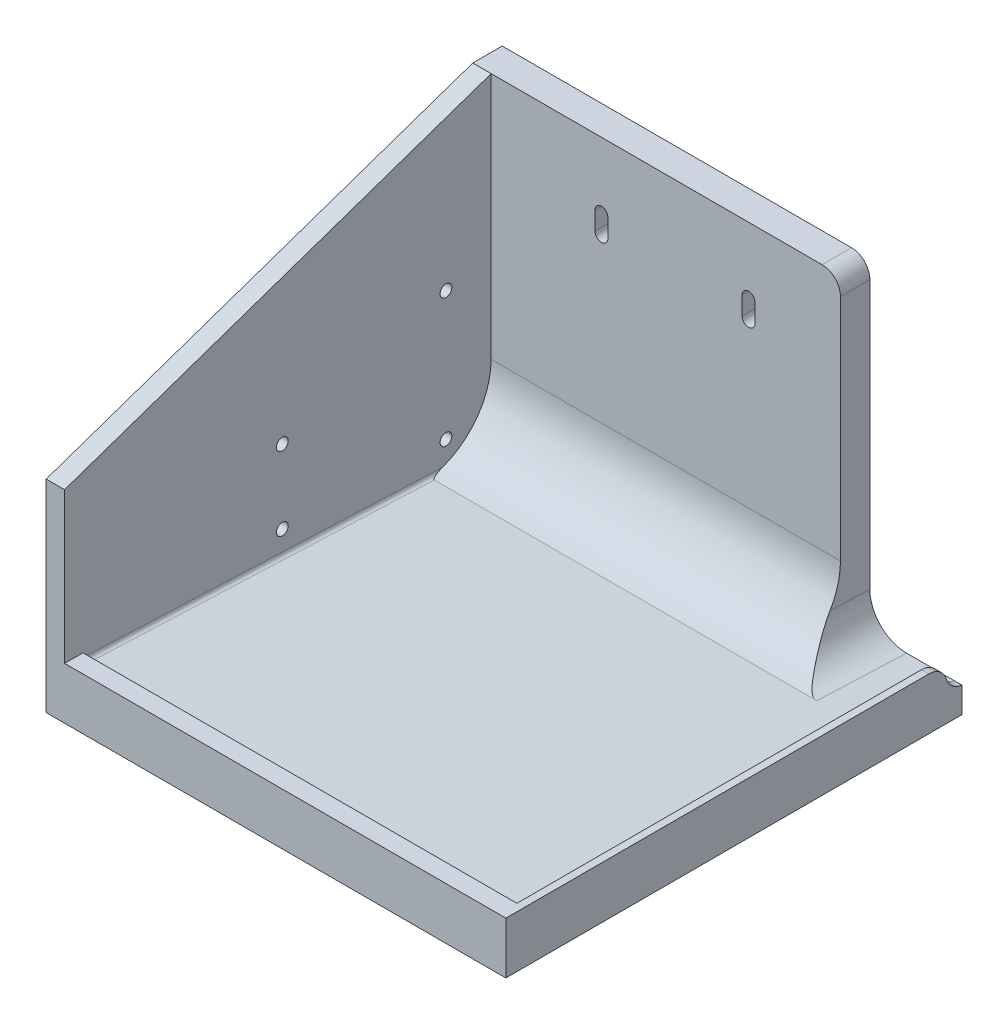
from build123d import *

# Parameters (mm, degrees)
SKETCH1_W            = 155
SKETCH1_H            = 5
BOSS_EXTRUDE2_DEPTH  = 55
SKETCH2_W            = 112
SKETCH2_H            = 45
SKETCH2_R            = 1.75
CUT_EXTRUDE1_DEPTH   = 55
SKETCH3_W            = 100
SKETCH3_H            = 20
CUT_EXTRUDE2_DEPTH   = 55
SKETCH4_W            = 40
SKETCH4_H            = 8.065867699
CUT_EXTRUDE3_DEPTH   = 55
BOSS_EXTRUDE4_DEPTH  = 5
CUT_EXTRUDE4_DEPTH   = 50
SKETCH9_W            = 4.377781836
SKETCH9_H            = 86.488706471
BOSS_EXTRUDE7_DEPTH  = 50
SKETCH10_W           = 20
SKETCH10_H           = 86.532324722
CUT_EXTRUDE5_DEPTH   = 10
SKETCH12_R           = 9.5
SKETCH12_R_2         = 6
CUT_EXTRUDE6_DEPTH   = 10
CUT_EXTRUDE7_START   = 50
SKETCH13_R           = 9.5
SKETCH13_R_2         = 6
CUT_EXTRUDE7_DEPTH   = 50
CUT_EXTRUDE8_DEPTH   = 50
CUT_EXTRUDE9_DEPTH   = 50
CUT_EXTRUDE10_DEPTH  = 10
FILLET5_R            = 3
SKETCH18_W           = 98.767816147
SKETCH18_H           = 10.604205858
BOSS_EXTRUDE8_DEPTH  = 5
CUT_EXTRUDE11_DEPTH  = 5
SKETCH20_W           = 155
SKETCH20_H           = 119
BOSS_EXTRUDE9_DEPTH  = 10
CUT_EXTRUDE13_DEPTH  = 155
SKETCH24_W           = 125
SKETCH24_H           = 8
BOSS_EXTRUDE10_DEPTH = 95
FILLET6_R            = 20
SKETCH26_W           = 16
SKETCH26_H           = 1.5
BOSS_EXTRUDE11_DEPTH = 12
BOSS_EXTRUDE12_DEPTH = 15
SKETCH28_R           = 2.5
CUT_EXTRUDE15_DEPTH  = 5
CUT_EXTRUDE17_DEPTH  = 35
SKETCH29_W           = 43
SKETCH29_H           = 43
CUT_EXTRUDE18_DEPTH  = 35
FILLET9_R            = 10
SKETCH31_W           = 124
SKETCH31_H           = 12
BOSS_EXTRUDE14_DEPTH = 2
SKETCH32_W           = 5
SKETCH32_H           = 2
BOSS_EXTRUDE15_DEPTH = 132
SKETCH33_W           = 20
SKETCH33_H           = 12
CUT_EXTRUDE19_DEPTH  = 160
SKETCH34_W           = 2
SKETCH34_H           = 12
BOSS_EXTRUDE17_DEPTH = 123
SKETCH36_R           = 6
CUT_EXTRUDE20_DEPTH  = 40
CUT_EXTRUDE21_DEPTH  = 25
SKETCH39_W           = 10
SKETCH39_H           = 12
CUT_EXTRUDE22_DEPTH  = 165
SKETCH40_W           = 2
SKETCH40_H           = 12
BOSS_EXTRUDE18_DEPTH = 115
SKETCH41_W           = 5
SKETCH41_H           = 64.538049938
BOSS_EXTRUDE19_DEPTH = 5
BOSS_EXTRUDE20_REACH = 223.912
SKETCH42_W           = 10
SKETCH42_H           = 124
SKETCH45_R           = 1.6
CUT_EXTRUDE23_DEPTH  = 30
SKETCH46_W           = 157.555653428
SKETCH46_H           = 97.617109351
CUT_EXTRUDE24_DEPTH  = 160
BOSS_EXTRUDE22_DEPTH = 120
SKETCH52_W           = 2
SKETCH52_H           = 14.095569493
BOSS_EXTRUDE23_DEPTH = 120
FILLET14_R           = 10
FILLET15_R           = 5
FILLET16_R           = 5
FILLET17_R           = 5
FILLET18_R           = 1
CUT_EXTRUDE27_DEPTH  = 30


with BuildPart() as part:
    # Sketch1 → Boss-Extrude2 (new body)
    with BuildSketch(Plane(origin=(0, 0, 0), x_dir=(1, 0, 0), z_dir=(0, 1, 0))):
        Polygon((-44.578450817, 29.59757322), (-48.782107146, 26.890310125), (-130, 153), (-125.796343671, 155.707263095), align=None)
        with BuildLine():
            ThreePointArc((0, 0), (-27.802696096, 7.256044178), (-48.782107146, 26.890310125))
            Line((-48.782107146, 26.890310125), (-44.578450817, 29.59757322))
            Line((-44.578450817, 29.59757322), (0, 5))
            Line((0, 5), (0, 0))
        make_face()
        with Locations((77.5, 2.5)):
            Rectangle(SKETCH1_W, SKETCH1_H)
    extrude(amount=BOSS_EXTRUDE2_DEPTH)

    # Sketch2 → Cut-Extrude1 (cut)
    with BuildSketch(Plane.XY):
        with Locations((99, 32.5)):
            Rectangle(SKETCH2_W, SKETCH2_H)
        with Locations((5, 25)):
            Circle(SKETCH2_R)
        with Locations((5, 50)):
            Circle(SKETCH2_R)
        with Locations((35, 50)):
            Circle(SKETCH2_R)
        with Locations((35, 25)):
            Circle(SKETCH2_R)
    extrude(amount=-CUT_EXTRUDE1_DEPTH, mode=Mode.SUBTRACT)

    # Sketch3 → Cut-Extrude2 (cut)
    with BuildSketch(Plane(origin=(-22.239707671, 0, 14.322945338), x_dir=(0.5414526190246729, 0, 0.840731265834287), z_dir=(-0.8407312658342869, 0, 0.5414526190246728))):
        with Locations((-99.020724146, 15)):
            Rectangle(SKETCH3_W, SKETCH3_H)
    extrude(amount=-CUT_EXTRUDE2_DEPTH, mode=Mode.SUBTRACT)

    # Sketch4 → Cut-Extrude3 (cut)
    with BuildSketch(Plane(origin=(2.114976352, 0, -3.832994761), x_dir=(-0.8755563671808256, 0, -0.48311597767939257), z_dir=(0.48311597767939257, 0, -0.8755563671808256))):
        with Locations((28.330006975, 9.03293385)):
            Rectangle(SKETCH4_W, SKETCH4_H)
    extrude(amount=-CUT_EXTRUDE3_DEPTH, mode=Mode.SUBTRACT)

    # Sketch5 → Boss-Extrude4 (add)
    with BuildSketch(Plane.XZ):
        Polygon((0, -5), (-44.578450817, -29.59757322), (-125.796343671, -155.707263095), (0, -155.707263095), align=None)
    extrude(amount=-BOSS_EXTRUDE4_DEPTH)

    # Sketch8 → Cut-Extrude4 (cut)
    with BuildSketch(Plane(origin=(0, 5, 0), x_dir=(1, 0, 0), z_dir=(0, 1, 0))):
        Polygon((-44.578450817, 29.59757322), (-98.72371272, 113.670699803), (-44.578450817, 113.670699803), align=None)
    extrude(amount=-CUT_EXTRUDE4_DEPTH, mode=Mode.SUBTRACT)

    # Sketch9 → Boss-Extrude7 (add)
    with BuildSketch(Plane(origin=(0, 5, 0), x_dir=(1, 0, 0), z_dir=(0, 1, 0))):
        with Locations((-42.389559899, 70.426346568)):
            Rectangle(SKETCH9_W, SKETCH9_H)
    extrude(amount=BOSS_EXTRUDE7_DEPTH)

    # Sketch10 → Cut-Extrude5 (cut)
    with BuildSketch(Plane(origin=(0, 5, 0), x_dir=(1, 0, 0), z_dir=(0, 1, 0))):
        with Locations((-30.200668981, 70.404537442)):
            Rectangle(SKETCH10_W, SKETCH10_H)
    extrude(amount=-CUT_EXTRUDE5_DEPTH, mode=Mode.SUBTRACT)

    # Sketch12 → Cut-Extrude6 (cut)
    with BuildSketch(Plane(origin=(-40.200668981, 0, 0), x_dir=(0, 0, -1), z_dir=(1, 0, 0))):
        with Locations(Location((57.181993332, 10, 0), (0, 0, 90))):
            Circle(SKETCH12_R)
        with Locations(Location((77.181993332, 10, 0), (0, 0, 90))):
            Circle(SKETCH12_R_2)
    extrude(amount=-CUT_EXTRUDE6_DEPTH, mode=Mode.SUBTRACT)

    # Sketch13 → Cut-Extrude7 (cut)
    with BuildSketch(Plane(origin=(-40.200668981, 0, 0), x_dir=(0, 0, -1), z_dir=(1, 0, 0)).offset(CUT_EXTRUDE7_START)):
        with Locations(Location((57.181993332, 10, 0), (0, 0, 90))):
            Circle(SKETCH13_R)
        with Locations(Location((77.181993332, 10, 0), (0, 0, 90))):
            Circle(SKETCH13_R_2)
    extrude(amount=-CUT_EXTRUDE7_DEPTH, mode=Mode.SUBTRACT)

    # Sketch14 → Cut-Extrude8 (cut)
    with BuildSketch(Plane(origin=(0, 5, 0), x_dir=(1, 0, 0), z_dir=(0, 1, 0))):
        Polygon((0, 103.038090201), (-91.876037903, 103.038090201), (-126.106254173, 155.707263095), (0, 155.707263095), align=None)
    extrude(amount=-CUT_EXTRUDE8_DEPTH, mode=Mode.SUBTRACT)

    # Sketch15 → Cut-Extrude9 (cut)
    with BuildSketch(Plane(origin=(-22.239707671, 0, 14.322945338), x_dir=(0.5414526190246729, 0, 0.840731265834287), z_dir=(-0.8407312658342869, 0, 0.5414526190246728))):
        Polygon((-176.035909688, 0), (-199.020724146, 18.247450711), (-199.020724146, 0), align=None)
    extrude(amount=-CUT_EXTRUDE9_DEPTH, mode=Mode.SUBTRACT)

    # Sketch16 → Cut-Extrude10 (cut)
    with BuildSketch(Plane(origin=(-40.200668981, 0, 0), x_dir=(0, 0, -1), z_dir=(1, 0, 0))):
        Polygon((113.670699803, 15.495236251), (48.252901996, 55), (113.670699803, 55), align=None)
    extrude(amount=-CUT_EXTRUDE10_DEPTH, mode=Mode.SUBTRACT)

    # Fillet5
    fillet5_edges = [part.edges().sort_by_distance(p)[0] for p in [
        (-100.847592598, 5, -112.302866383),
        (-46.680278982, 25, -28.243941672),
        (-46.680278982, 5, -28.243941672),
        (-100.825540884, 25, -112.317068256),
    ]]
    fillet(fillet5_edges, radius=FILLET5_R)

    # Sketch18 → Boss-Extrude8 (add)
    with BuildSketch(Plane(origin=(0, 5, 0), x_dir=(1, 0, 0), z_dir=(0, 1, 0))):
        with Locations((-49.383908074, 108.34019313)):
            Rectangle(SKETCH18_W, SKETCH18_H)
    extrude(amount=-BOSS_EXTRUDE8_DEPTH)

    # Sketch19 → Cut-Extrude11 (cut)
    with BuildSketch(Plane.XZ):
        Polygon((-97.82324149, -103.038090201), (-98.767816147, -104.504762295), (-98.767816147, -103.038090201), align=None)
    extrude(amount=-CUT_EXTRUDE11_DEPTH, mode=Mode.SUBTRACT)

    # Sketch20 → Boss-Extrude9 (add)
    with BuildSketch(Plane.XZ):
        with Locations((77.5, -64.5)):
            Rectangle(SKETCH20_W, SKETCH20_H)
    extrude(amount=-BOSS_EXTRUDE9_DEPTH)

    # Sketch21 → Cut-Extrude13 (cut)
    with BuildSketch(Plane(origin=(155, 0, 0), x_dir=(0, 0, -1), z_dir=(1, 0, 0))):
        Polygon((5, 10), (124, 10), (124, 7), align=None)
    extrude(amount=-CUT_EXTRUDE13_DEPTH, mode=Mode.SUBTRACT)

    # Sketch24 → Boss-Extrude10 (add)
    with BuildSketch(Plane.XZ):
        with Locations((62.5, -120)):
            Rectangle(SKETCH24_W, SKETCH24_H)
    extrude(amount=-BOSS_EXTRUDE10_DEPTH)

    # Fillet6
    fillet6_edges = [part.edges().sort_by_distance(p)[0] for p in [
        (62.5, 7.201680672, -116),
    ]]
    fillet(fillet6_edges, radius=FILLET6_R)

    # Sketch26 → Boss-Extrude11 (add)
    with BuildSketch(Plane(origin=(2.114976352, 0, -3.832994761), x_dir=(-0.8755563671808256, 0, -0.48311597767939257), z_dir=(0.48311597767939257, 0, -0.8755563671808256))):
        with Locations((28.330006975, 13.815867699)):
            Rectangle(SKETCH26_W, SKETCH26_H)
    extrude(amount=BOSS_EXTRUDE11_DEPTH)

    # Sketch27 → Boss-Extrude12 (add)
    with BuildSketch(Plane(origin=(0, 14.565867699, 0), x_dir=(1, 0, 0), z_dir=(0, 1, 0))):
        Polygon((-15.6850907, 13.654745957), (-9.887698968, 24.161422363), (-23.896600843, 31.891278006), (-29.693992575, 21.384601599), (-28.030435477, 20.466681242), (-23.150964103, 29.30980055), (-12.469176423, 23.415785623), (-17.348647798, 14.572666314), align=None)
    extrude(amount=BOSS_EXTRUDE12_DEPTH)

    # Sketch28 → Cut-Extrude15 (cut)
    with BuildSketch(Plane(origin=(0, 14.565867699, 0), x_dir=(1, 0, 0), z_dir=(0, 1, 0))):
        with Locations(Location((-20.24980595, 21.941233432, 0), (0, 0, 180))):
            Circle(SKETCH28_R)
    extrude(amount=-CUT_EXTRUDE15_DEPTH, mode=Mode.SUBTRACT)

    # Sketch25 → Cut-Extrude17 (cut)
    with BuildSketch(Plane(origin=(0, 0, -124), x_dir=(-1, 0, 0), z_dir=(0, 0, -1))):
        with BuildLine():
            Line((-36.75, 77), (-36.75, 72))
            ThreePointArc((-36.75, 72), (-35, 70.25), (-33.25, 72))
            Line((-33.25, 72), (-33.25, 77))
            ThreePointArc((-33.25, 77), (-35, 78.75), (-36.75, 77))
        make_face()
        with BuildLine():
            Line((-73.25, 77), (-73.25, 72))
            ThreePointArc((-73.25, 72), (-75, 70.25), (-76.75, 72))
            Line((-76.75, 72), (-76.75, 77))
            ThreePointArc((-76.75, 77), (-75, 78.75), (-73.25, 77))
        make_face()
    extrude(amount=-CUT_EXTRUDE17_DEPTH, mode=Mode.SUBTRACT)

    # Sketch29 → Cut-Extrude18 (cut)
    with BuildSketch(Plane.XY):
        with Locations((21.5, 33.5)):
            Rectangle(SKETCH29_W, SKETCH29_H)
    extrude(amount=-CUT_EXTRUDE18_DEPTH, mode=Mode.SUBTRACT)

    # Fillet9
    fillet9_edges = [part.edges().sort_by_distance(p)[0] for p in [
        (-115.522140631, 0, -134.985040643),
        (-127.898171835, 18.247450711, -154.353631548),
        (-42.389559899, 15.495236251, -113.670699803),
        (-42.389559899, 55, -48.252901996),
        (-127.898171835, 55, -154.353631548),
    ]]
    fillet(fillet9_edges, radius=FILLET9_R)

    # Sketch31 → Boss-Extrude14 (add)
    with BuildSketch(Plane(origin=(155, 0, 0), x_dir=(0, 0, -1), z_dir=(1, 0, 0))):
        with Locations((62, 6)):
            Rectangle(SKETCH31_W, SKETCH31_H)
    extrude(amount=-BOSS_EXTRUDE14_DEPTH)

    # Sketch32 → Boss-Extrude15 (add)
    with BuildSketch(Plane.ZY.offset(-153)):
        with Locations((-2.5, 11)):
            Rectangle(SKETCH32_W, SKETCH32_H)
    extrude(amount=BOSS_EXTRUDE15_DEPTH)

    # Sketch33 → Cut-Extrude19 (cut)
    with BuildSketch(Plane.XY):
        with Locations((145, 6)):
            Rectangle(SKETCH33_W, SKETCH33_H)
    extrude(amount=-CUT_EXTRUDE19_DEPTH, mode=Mode.SUBTRACT)

    # Sketch34 → Boss-Extrude17 (add)
    with BuildSketch(Plane.XY):
        with Locations((134, 6)):
            Rectangle(SKETCH34_W, SKETCH34_H)
    extrude(amount=-BOSS_EXTRUDE17_DEPTH)

    # Sketch36 → Cut-Extrude20 (cut, symmetric)
    with BuildSketch(Plane(origin=(-40.200668981, 0, 0), x_dir=(0, 0, -1), z_dir=(1, 0, 0))):
        with Locations(Location((90.194878088, 10, 0), (0, 0, 90))):
            Circle(SKETCH36_R)
    extrude(amount=CUT_EXTRUDE20_DEPTH, both=True, mode=Mode.SUBTRACT)

    # Sketch38 → Cut-Extrude21 (cut)
    with BuildSketch(Plane(origin=(125, 0, 0), x_dir=(0, 0, -1), z_dir=(1, 0, 0))):
        Polygon((95.495958465, 7.718589282), (124, 7), (124, 95), (116, 95), align=None)
    extrude(amount=-CUT_EXTRUDE21_DEPTH, mode=Mode.SUBTRACT)

    # Sketch39 → Cut-Extrude22 (cut)
    with BuildSketch(Plane.XY):
        with Locations((130, 6)):
            Rectangle(SKETCH39_W, SKETCH39_H)
    extrude(amount=-CUT_EXTRUDE22_DEPTH, mode=Mode.SUBTRACT)

    # Sketch40 → Boss-Extrude18 (add)
    with BuildSketch(Plane.XY):
        with Locations((124, 6)):
            Rectangle(SKETCH40_W, SKETCH40_H)
    extrude(amount=-BOSS_EXTRUDE18_DEPTH)

    # Sketch41 → Boss-Extrude19 (add)
    with BuildSketch(Plane(origin=(0, 5, 0), x_dir=(1, 0, 0), z_dir=(0, 1, 0))):
        with Locations((-2.5, 81.37327109)):
            Rectangle(SKETCH41_W, SKETCH41_H)
    extrude(amount=-BOSS_EXTRUDE19_DEPTH)

    # Boss-Extrude20: up to this face of the body (flat: up to its plane)
    boss_extrude20_end = Plane(part.part.faces().sort_by_distance((50, 95, -120))[0])
    # Sketch42 → Boss-Extrude20 (add, up to the picked face)
    with BuildSketch(Plane(origin=(0, 5, 0), x_dir=(1, 0, 0), z_dir=(0, 1, 0)), mode=Mode.PRIVATE) as boss_extrude20_sk1:
        with Locations((0, 62)):
            Rectangle(SKETCH42_W, SKETCH42_H)
    boss_extrude20_tool1 = split(extrude(boss_extrude20_sk1.sketch, amount=BOSS_EXTRUDE20_REACH, mode=Mode.PRIVATE), bisect_by=boss_extrude20_end, keep=Keep.BOTH, mode=Mode.PRIVATE)
    add(boss_extrude20_tool1.solids().sort_by(Axis((0, 5, -62), (0, 1, 0)))[0])

    # Sketch45 → Cut-Extrude23 (cut)
    with BuildSketch(Plane(origin=(5, 0, 0), x_dir=(0, 0, -1), z_dir=(1, 0, 0))):
        with Locations(Location((59.208509529, 36.135781847, 0), (0, 0, 90))):
            Circle(SKETCH45_R)
        with Locations(Location((59.208509529, 16.135781847, 0), (0, 0, 90))):
            Circle(SKETCH45_R)
        with Locations(Location((103.718271361, 50.013687011, 0), (0, 0, 90))):
            Circle(SKETCH45_R)
        with Locations(Location((103.718271361, 15.013687011, 0), (0, 0, 90))):
            Circle(SKETCH45_R)
    extrude(amount=-CUT_EXTRUDE23_DEPTH, mode=Mode.SUBTRACT)

    # Sketch46 → Cut-Extrude24 (cut)
    with BuildSketch(Plane.XY):
        with Locations((-78.777826714, 48.808554676)):
            Rectangle(SKETCH46_W, SKETCH46_H)
    extrude(amount=-CUT_EXTRUDE24_DEPTH, mode=Mode.SUBTRACT)

    # Sketch51 → Boss-Extrude22 (add)
    with BuildSketch(Plane(origin=(125, 0, 0), x_dir=(0, 0, -1), z_dir=(1, 0, 0))):
        Polygon((124, 7), (5, 12), (5, 14.095569493), (0, 14.095569493), (0, 7.113445378), align=None)
    extrude(amount=-BOSS_EXTRUDE22_DEPTH)

    # Sketch52 → Boss-Extrude23 (add)
    with BuildSketch(Plane.XY):
        with Locations((124, 7.047784747)):
            Rectangle(SKETCH52_W, SKETCH52_H)
    extrude(amount=-BOSS_EXTRUDE23_DEPTH)

    # Fillet14
    fillet14_edges = [part.edges().sort_by_distance(p)[0] for p in [
        (100, 7.513892889, -111.769349239),
    ]]
    fillet(fillet14_edges, radius=FILLET14_R)

    # Fillet15
    fillet15_edges = [part.edges().sort_by_distance(p)[0] for p in [
        (124, 14.095569493, -120),
    ]]
    fillet(fillet15_edges, radius=FILLET15_R)

    # Fillet16
    # the kernel refuses this fillet: 5 mm, written as the material it adds along each edge
    with BuildSketch(Plane(origin=(123, 7.168067227, -120), x_dir=(0, 0.9980473315851939, 0.062462179882501946), z_dir=(1, 0, 0))) as fillet16_piece_1:
        with BuildLine():
            CenterArc((4.502899102, -4.869840665), FILLET16_R, 103.101980319, 66.66628485)
            Line((-0.417587767, -3.981691481), (-0.909636454, -3.892876563))
            ThreePointArc((-0.909636454, -3.892876563), (-0.706066567, -1.938693285), (-0.497272683, 0.052152456))
            Line((-0.497272683, 0.052152456), (0.03123109, 0.499023666))
            ThreePointArc((0.03123109, 0.499023666), (1.954969583, 0.378627673), (3.256131762, 0.486984066))
            Line((3.256131762, 0.486984066), (3.369474248, 0))
        make_face()
    extrude(amount=2)

    # Fillet17
    fillet17_edges = [part.edges().sort_by_distance(p)[0] for p in [
        (100, 95, -120),
    ]]
    fillet(fillet17_edges, radius=FILLET17_R)

    # Fillet18
    fillet18_edges = [part.edges().sort_by_distance(p)[0] for p in [
        (5, 10.013892889, -52.269349239),
    ]]
    fillet(fillet18_edges, radius=FILLET18_R)

    # Sketch54 → Cut-Extrude27 (cut)
    with BuildSketch(Plane(origin=(5, 0, 0), x_dir=(0, 0, -1), z_dir=(1, 0, 0))):
        Polygon((0, 55), (116, 95), (0, 95), align=None)
    extrude(amount=-CUT_EXTRUDE27_DEPTH, mode=Mode.SUBTRACT)


solid = part.part
